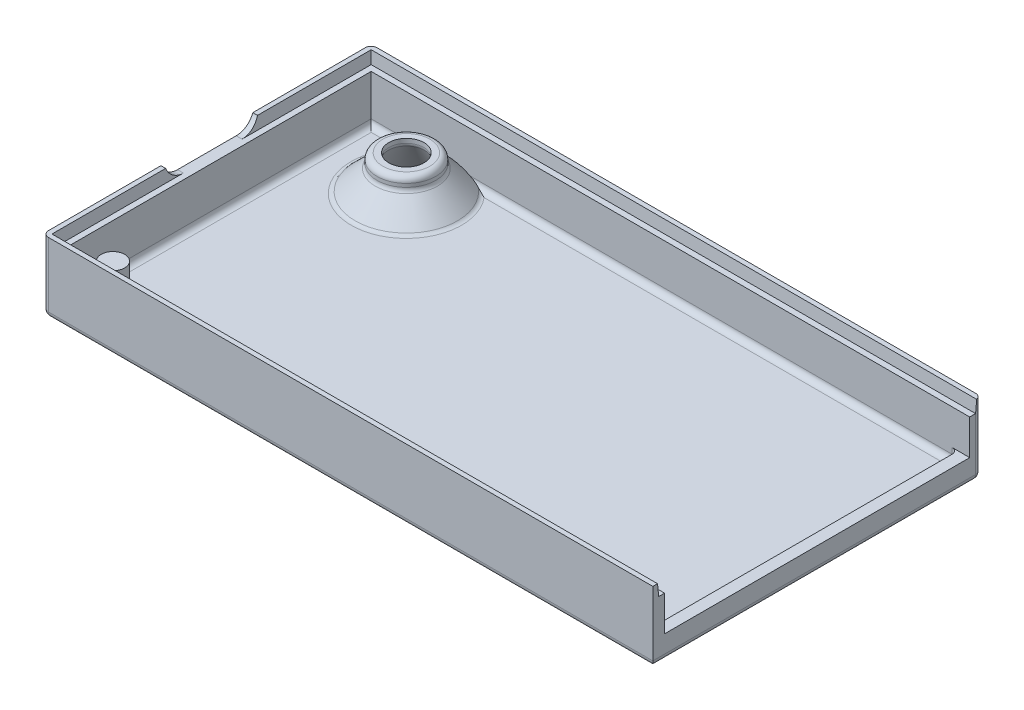
from build123d import *

# Parameters (mm, degrees)
SKETCH_1_W          = 52
SKETCH_1_H          = 28
EXTRUDE_1_DEPTH     = 6
SKETCH_2_W          = 50
SKETCH_2_H          = 26
CUT_EXTRUDE_1_DEPTH = 5
SKETCH_3_W          = 1
SKETCH_3_H          = 26
CUT_EXTRUDE_2_DEPTH = 4
CUT_EXTRUDE_3_REACH = 56.185
SKETCH_6_R          = 1.5
CUT_EXTRUDE_4_DEPTH = 4
EXTRUDE_START       = 3
SKETCH_7_R          = 2.5
SKETCH_7_R_2        = 1.5
SKETCH_7_R_3        = 1
EXTRUDE_3_DEPTH     = 3
CHAMFER_2_SIZE      = 2
CHAMFER_3_SIZE      = 3.5
CHAMFER_3_SIZE2     = 2
FILLET_1_R          = 0.5
FILLET_2_R          = 0.5
EXTRUDE_4_REACH     = 32.799
EXTRUDE_START_2     = -1
SKETCH_9_W          = 0.8
SKETCH_9_H          = 2
CUT_EXTRUDE_5_DEPTH = 1
CHAMFER_4_SIZE      = 1
CHAMFER_4_SIZE_2    = 0.1


# Some blends are built 0.0001 mm under size
with BuildPart() as part:
    # Эскиз1 → Бобышка-Вытянуть1 (new body)
    with BuildSketch(Plane(origin=(0, 0, 0), x_dir=(1, 0, 0), z_dir=(0, 1, 0))):
        Rectangle(SKETCH_1_W, SKETCH_1_H)
    extrude(amount=EXTRUDE_1_DEPTH)

    # Эскиз2 → Вырез-Вытянуть1 (cut)
    with BuildSketch(Plane(origin=(0, 6, 0), x_dir=(1, 0, 0), z_dir=(0, 1, 0))):
        Rectangle(SKETCH_2_W, SKETCH_2_H)
    extrude(amount=-CUT_EXTRUDE_1_DEPTH, mode=Mode.SUBTRACT)

    # Эскиз3 → Вырез-Вытянуть2 (cut)
    with BuildSketch(Plane(origin=(0, 6, 0), x_dir=(1, 0, 0), z_dir=(0, 1, 0))):
        with Locations((25.5, 0)):
            Rectangle(SKETCH_3_W, SKETCH_3_H)
    extrude(amount=-CUT_EXTRUDE_2_DEPTH, mode=Mode.SUBTRACT)

    # Эскиз4 → Вырез-Вытянуть3 (cut, up to next)
    with BuildSketch(Plane.ZY.offset(26), mode=Mode.PRIVATE) as cut_extrude_3_sk1:
        with BuildLine():
            Line((-2.5, 8), (2.5, 8))
            ThreePointArc((2.5, 8), (4, 6.5), (2.5, 5))
            Line((2.5, 5), (-2.5, 5))
            ThreePointArc((-2.5, 5), (-4, 6.5), (-2.5, 8))
        make_face()
    cut_extrude_3_tool1 = extrude(cut_extrude_3_sk1.sketch, amount=-CUT_EXTRUDE_3_REACH, mode=Mode.PRIVATE) & part.part
    add(cut_extrude_3_tool1.solids().sort_by_distance((-26, 6.5, 0))[0], mode=Mode.SUBTRACT)

    # Эскиз6 → Вырез-Вытянуть4 (cut)
    with BuildSketch(Plane(origin=(0, 1, 0), x_dir=(1, 0, 0), z_dir=(0, 1, 0))):
        with Locations(Location((-18.5, 9.5, 0), (0, 0, 270))):
            Circle(SKETCH_6_R)
    extrude(amount=-CUT_EXTRUDE_4_DEPTH, mode=Mode.SUBTRACT)

    # Эскиз7 → Бобышка-Вытянуть3 (add)
    # profile 1 of 2: a face of its own
    with BuildSketch(Plane(origin=(0, 1, 0), x_dir=(1, 0, 0), z_dir=(0, 1, 0)).offset(EXTRUDE_START)):
        with Locations(Location((-18.5, 9.5, 0), (0, 0, 270))):
            Circle(SKETCH_7_R)
        with Locations(Location((-18.5, 9.5, 0), (0, 0, 270))):
            Circle(SKETCH_7_R_2, mode=Mode.SUBTRACT)
    # profile 2 of 2: a face of its own
    with BuildSketch(Plane(origin=(0, 1, 0), x_dir=(1, 0, 0), z_dir=(0, 1, 0)).offset(EXTRUDE_START)):
        with Locations(Location((-23, -11, 0), (0, 0, 270))):
            Circle(SKETCH_7_R_3)
    extrude(amount=-EXTRUDE_3_DEPTH)

    # Фаска2
    # the kernel refuses this chamfer: 2 mm, written as the material it adds along each edge
    with BuildSketch(Plane(origin=(-18.5, 1, -9.5), x_dir=(0, 0, 1), z_dir=(-1, 0, 0))) as chamfer_2_piece_1:
        Polygon((2.5 + CHAMFER_2_SIZE, 0), (2.5, CHAMFER_2_SIZE), (2.5, 0), align=None)
    revolve(axis=Axis((-18.5, 1, -9.5), (0, 1, 0)))

    # Фаска3
    chamfer_3_edges = [part.edges().sort_by_distance(p)[0] for p in [
        (-18.5, 0, -11),
    ]]
    chamfer_3_side = [part.faces().sort_by_distance(p)[0] for p in [
        (-18.5, 2, -11),
    ]]
    chamfer(chamfer_3_edges, length=CHAMFER_3_SIZE, length2=CHAMFER_3_SIZE2, reference=chamfer_3_side[0])

    # Скругление1
    fillet_1_edges = [part.edges().sort_by_distance(p)[0] for p in [
        (-25, 1, 0),
        (4.664213562, 1, -13),
        (-23.164213562, 1, -13),
        (25, 1, 0),
        (0, 1, 13),
        (-22.742640687, 1, -8),
        (0, 0, -14),
        (-26, 0, 0),
        (0, 0, 14),
        (26, 0, 0),
        (-18.5, 0, -13),
        (-18.5, 4, -12),
        (-18.5, 3, -12),
        (25, 1.5, -13),
        (25, 1.5, 13),
        (26, 3, -14),
        (-26, 3, -14),
        (-26, 3, 14),
        (-18.5, 3.5, -11),
    ]]
    fillet(fillet_1_edges, radius=FILLET_1_R)

    # Скругление2
    fillet_2_edges = [part.edges().sort_by_distance(p)[0] for p in [
        (-23, 1, 10),
    ]]
    fillet(fillet_2_edges, radius=FILLET_2_R - 0.0001)  # a hair under: the kernel refuses the full size

    # Эскиз9 → Бобышка-Вытянуть4 (add, up to next)
    with BuildSketch(Plane(origin=(0, 4, 0), x_dir=(1, 0, 0), z_dir=(0, 1, 0)).offset(EXTRUDE_START_2), mode=Mode.PRIVATE) as extrude_4_sk1:
        with Locations((-23, -12)):
            Rectangle(SKETCH_9_W, SKETCH_9_H)
    extrude_4_tool1 = extrude(extrude_4_sk1.sketch, amount=-EXTRUDE_4_REACH, mode=Mode.PRIVATE) - part.part
    # Эскиз9 → Бобышка-Вытянуть4 (add, up to next)
    with BuildSketch(Plane(origin=(0, 4, 0), x_dir=(1, 0, 0), z_dir=(0, 1, 0)).offset(EXTRUDE_START_2), mode=Mode.PRIVATE) as extrude_4_sk2:
        Polygon((-25, -11), (-25, -11.4), (-23, -11.4), (-23, -11), (-23, -10.6), (-25, -10.6), align=None)
    extrude_4_tool2 = extrude(extrude_4_sk2.sketch, amount=-EXTRUDE_4_REACH, mode=Mode.PRIVATE) - part.part
    add(extrude_4_tool1.solids().sort_by_distance((-23, 3, 12))[0])
    add(extrude_4_tool2.solids().sort_by_distance((-24, 3, 11))[0])

    # Эскиз10 → Вырез-Вытянуть5 (cut)
    with BuildSketch(Plane(origin=(0, 6, 0), x_dir=(1, 0, 0), z_dir=(0, 1, 0))):
        Polygon((26, 13), (26, 13.5), (-25.5, 13.5), (-25.5, -13.5), (26, -13.5), (26, -13), (-25, -13), (-25, 13), align=None)
    extrude(amount=-CUT_EXTRUDE_5_DEPTH, mode=Mode.SUBTRACT)

    # Фаска4
    # the kernel refuses this chamfer: 1, 0.1 mm, written as the material it takes off along each edge
    with BuildSketch(Plane(origin=(-25.5, 6, -16.099522763), x_dir=(0, -1, 0), z_dir=(0, 0, 1))) as chamfer_4_piece_1_section:
        Polygon((CHAMFER_4_SIZE, 0), (0, -CHAMFER_4_SIZE_2), (0, 0), align=None)
    chamfer_4_piece_1 = extrude(amount=14.784831964, mode=Mode.PRIVATE)
    chamfer_4_piece_1 = split(chamfer_4_piece_1, bisect_by=Plane(origin=(-25.5, 6.247477501, -13.62474775), z_dir=(0, 0.09950371902099857, 0.9950371902099893)), keep=Keep.TOP, mode=Mode.PRIVATE)
    add(chamfer_4_piece_1, mode=Mode.SUBTRACT)
    with BuildSketch(Plane(origin=(28.599522763, 6, -13.5), x_dir=(0, -1, 0), z_dir=(-1, 0, 0))) as chamfer_4_piece_2_section:
        Polygon((CHAMFER_4_SIZE, 0), (0, -CHAMFER_4_SIZE_2), (0, 0), align=None)
    chamfer_4_piece_2 = extrude(amount=56.699045526, mode=Mode.PRIVATE)
    chamfer_4_piece_2 = split(chamfer_4_piece_2, bisect_by=Plane(origin=(-25.063371062, 0.633710618, -13.5), z_dir=(0.995037190209989, 0.09950371902100032, 0)), keep=Keep.TOP, mode=Mode.PRIVATE)
    add(chamfer_4_piece_2, mode=Mode.SUBTRACT)
    with BuildSketch(Plane(origin=(-28.099522763, 6, 13.5), x_dir=(0, -1, 0), z_dir=(1, 0, 0))) as chamfer_4_piece_3_section:
        Polygon((CHAMFER_4_SIZE, 0), (0, -CHAMFER_4_SIZE_2), (0, 0), align=None)
    chamfer_4_piece_3 = extrude(amount=56.699045526, mode=Mode.PRIVATE)
    chamfer_4_piece_3 = split(chamfer_4_piece_3, bisect_by=Plane(origin=(-25.62474775, 6.247477501, 13.5), z_dir=(0.995037190209989, 0.09950371902100032, 0)), keep=Keep.TOP, mode=Mode.PRIVATE)
    add(chamfer_4_piece_3, mode=Mode.SUBTRACT)
    with BuildSketch(Plane(origin=(-25.5, 6, 1.314690799), x_dir=(0, -1, 0), z_dir=(0, 0, 1))) as chamfer_4_piece_4_section:
        Polygon((CHAMFER_4_SIZE, 0), (0, -CHAMFER_4_SIZE_2), (0, 0), align=None)
    chamfer_4_piece_4 = extrude(amount=14.784831964, mode=Mode.PRIVATE)
    chamfer_4_piece_4 = split(chamfer_4_piece_4, bisect_by=Plane(origin=(-25.5, 4.783632752, 13.478363275), z_dir=(0, 0.09950371902099857, -0.9950371902099893)), keep=Keep.TOP, mode=Mode.PRIVATE)
    add(chamfer_4_piece_4, mode=Mode.SUBTRACT)


solid = part.part
